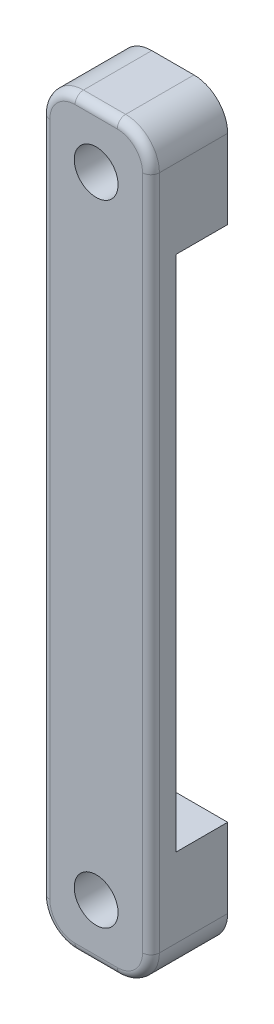
from build123d import *

# Parameters (mm, degrees)
SKETCH1_W           = 13
SKETCH1_H           = 88.15
BOSS_EXTRUDE1_DEPTH = 3
SKETCH2_W           = 13
SKETCH2_H           = 13.375
SKETCH2_R           = 2.6
BOSS_EXTRUDE2_DEPTH = 6.1
SKETCH2_3_R         = 2.6
CUT_EXTRUDE1_DEPTH  = 71.139493751
FILLET3_R           = 4
FILLET2_R           = 1


with BuildPart() as part:
    # Sketch1 → Boss-Extrude1 (new body)
    with BuildSketch(Plane.XY):
        with Locations((0.802799371, 25.416062051)):
            Rectangle(SKETCH1_W, SKETCH1_H)
    extrude(amount=BOSS_EXTRUDE1_DEPTH)

    # Sketch2 → Boss-Extrude2 (add)
    # profile 1 of 2: a face of its own
    with BuildSketch(Plane(origin=(0, 0, 0), x_dir=(-1, 0, 0), z_dir=(0, 0, -1))):
        with Locations((-0.802799371, -11.971437949)):
            Rectangle(SKETCH2_W, SKETCH2_H)
        with Locations((-0.802799371, -11.971437949)):
            Circle(SKETCH2_R, mode=Mode.SUBTRACT)
    # profile 2 of 2: a face of its own
    with BuildSketch(Plane(origin=(0, 0, 0), x_dir=(-1, 0, 0), z_dir=(0, 0, -1))):
        with Locations((-0.802799371, 62.803562051)):
            Rectangle(SKETCH2_W, SKETCH2_H)
        with Locations((-0.802799371, 62.803562051)):
            Circle(SKETCH2_R, mode=Mode.SUBTRACT)
    extrude(amount=BOSS_EXTRUDE2_DEPTH)

    # Sketch2<3> → Cut-Extrude1 (cut, through all)
    with BuildSketch(Plane(origin=(0, 0, 0), x_dir=(-1, 0, 0), z_dir=(0, 0, -1))):
        with Locations((-0.802799371, -11.971437949)):
            Circle(SKETCH2_3_R)
        with Locations((-0.802799371, 62.803562051)):
            Circle(SKETCH2_3_R)
    extrude(amount=-CUT_EXTRUDE1_DEPTH, mode=Mode.SUBTRACT)

    # Fillet3
    fillet3_edges = [part.edges().sort_by_distance(p)[0] for p in [
        (7.302799371, -18.658937949, -1.55),
        (-5.697200629, -18.658937949, -1.55),
        (7.302799371, 69.491062051, -1.55),
        (-5.697200629, 69.491062051, -1.55),
    ]]
    fillet(fillet3_edges, radius=FILLET3_R)

    # Fillet2
    fillet2_edges = [part.edges().sort_by_distance(p)[0] for p in [
        (0.802799371, -18.658937949, 3),
        (0.802799371, 69.491062051, 3),
        (7.302799371, 25.416062051, 3),
        (-5.697200629, 25.416062051, 3),
        (-4.525627753, 68.319489176, 3),
        (6.131226496, 68.319489176, 3),
        (6.131226496, -17.487365074, 3),
        (-4.525627753, -17.487365074, 3),
    ]]
    fillet(fillet2_edges, radius=FILLET2_R)


solid = part.part
